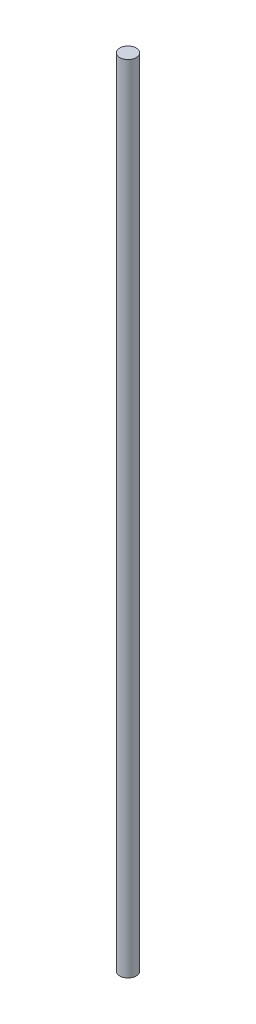
from build123d import *

# Parameters (mm, degrees)
SKETCH1_R           = 1.5875
BOSS_EXTRUDE1_DEPTH = 152.4


with BuildPart() as part:
    # Sketch1 → Boss-Extrude1 (new body)
    with BuildSketch(Plane(origin=(0, 0, 0), x_dir=(1, 0, 0), z_dir=(0, 1, 0))):
        Circle(SKETCH1_R)
    extrude(amount=BOSS_EXTRUDE1_DEPTH)


solid = part.part
